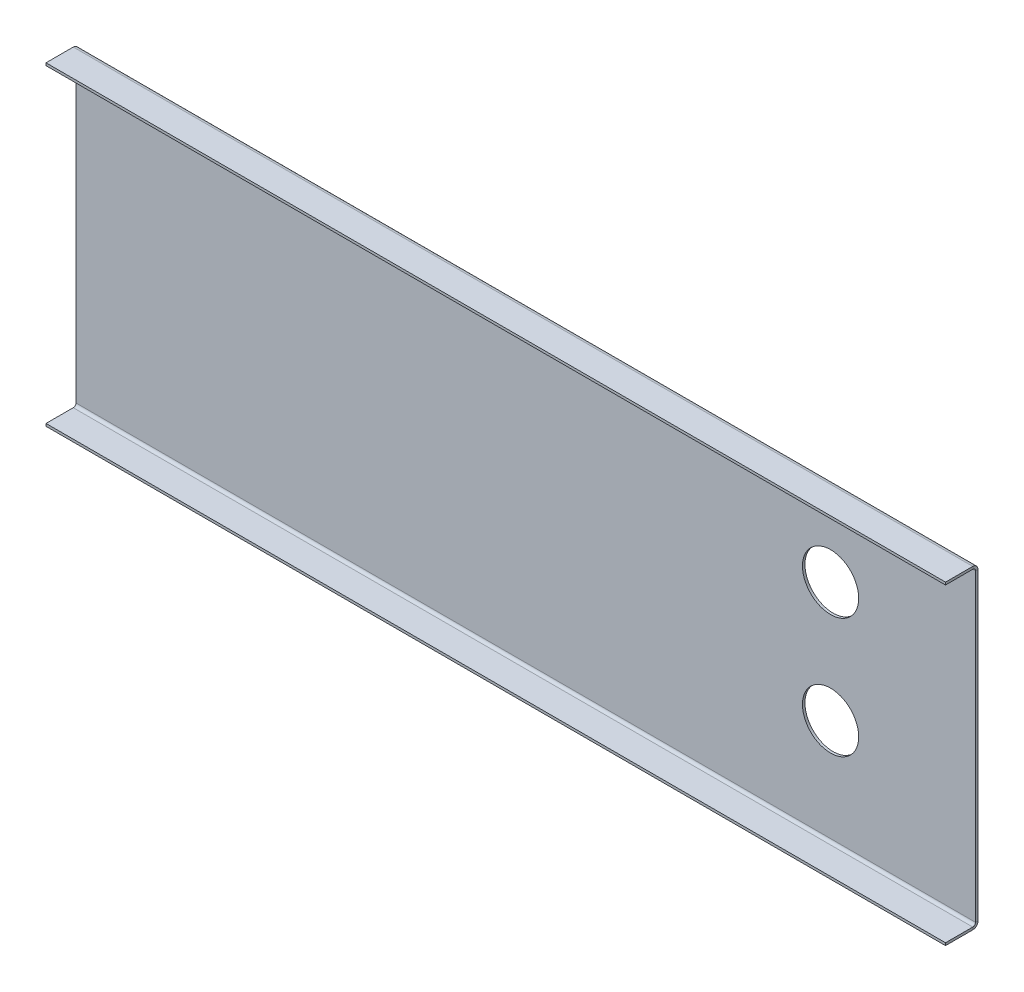
from build123d import *

# Parameters (mm, degrees)
SKETCH_1_W                         = 360
SKETCH_1_H                         = 124
SM_BASE_FLANGE_1_DEPTH             = 1
SM_EDGE_FLANGE_1_STRIP_W           = 6.2
SM_EDGE_FLANGE_1_STRIP_H           = 1
SM_EDGE_FLANGE_1_STRIP_CUT_DEPTH   = 360
SM_EDGE_FLANGE_1_STRIP_2_W         = 6.2
SM_EDGE_FLANGE_1_STRIP_2_H         = 1
SM_EDGE_FLANGE_1_STRIP_CUT_2_DEPTH = 360
SM_EDGE_FLANGE_1_DEPTH             = 360
SM_EDGE_FLANGE_1_BEND_DEPTH        = 360
SKETCH_8_R                         = 11.25
CUT_EXTRUDE_1_DEPTH                = 10


# Sheet-metal steps are written as plain solids
with BuildPart() as part:
    # Sketch 1 → Базовая кромка1 (new body)
    with BuildSketch(Plane.XY):
        with Locations((122.300049421, -36.452668213)):
            Rectangle(SKETCH_1_W, SKETCH_1_H)
    extrude(amount=-SM_BASE_FLANGE_1_DEPTH)

    # Ребро-кромка1 strip (across the edge) → Ребро-кромка1 strip cut (cut)
    with BuildSketch(Plane(origin=(302.300049421, 25.547331787, 0), x_dir=(0, -1, 0), z_dir=(-1, 0, 0))):
        with Locations((-2, -0.5)):
            Rectangle(SM_EDGE_FLANGE_1_STRIP_W, SM_EDGE_FLANGE_1_STRIP_H)
    extrude(amount=SM_EDGE_FLANGE_1_STRIP_CUT_DEPTH, mode=Mode.SUBTRACT)

    # Ребро-кромка1 strip 2 (across the edge) → Ребро-кромка1 strip cut 2 (cut)
    with BuildSketch(Plane(origin=(-57.699950579, -98.452668213, 0), x_dir=(0, 1, 0), z_dir=(1, 0, 0))):
        with Locations((-2, -0.5)):
            Rectangle(SM_EDGE_FLANGE_1_STRIP_2_W, SM_EDGE_FLANGE_1_STRIP_2_H)
    extrude(amount=SM_EDGE_FLANGE_1_STRIP_CUT_2_DEPTH, mode=Mode.SUBTRACT)

    # Ребро-кромка1 section (across the edge) → Ребро-кромка1 (add)
    with BuildSketch(Plane(origin=(302.300049421, 25.547331787, 0), x_dir=(0, -1, 0), z_dir=(-1, 0, 0))):
        with BuildLine():
            Line((-1, 1.1), (-1, 12))
            Line((-1, 12), (0, 12))
            Line((0, 12), (0, 1.1))
            ThreePointArc((0, 1.1), (0.322182541, 0.322182541), (1.1, 0))
            Line((1.1, 0), (1.1, -1))
            ThreePointArc((1.1, -1), (-0.38492424, -0.38492424), (-1, 1.1))
        make_face()
    extrude(amount=SM_EDGE_FLANGE_1_DEPTH)

    # Ребро-кромка1 section 2 (across the edge) → Ребро-кромка1 bend (add)
    with BuildSketch(Plane(origin=(-57.699950579, -98.452668213, 0), x_dir=(0, 1, 0), z_dir=(1, 0, 0))):
        with BuildLine():
            Line((-1, 1.1), (-1, 12))
            Line((-1, 12), (0, 12))
            Line((0, 12), (0, 1.1))
            ThreePointArc((0, 1.1), (0.322182541, 0.322182541), (1.1, 0))
            Line((1.1, 0), (1.1, -1))
            ThreePointArc((1.1, -1), (-0.38492424, -0.38492424), (-1, 1.1))
        make_face()
    extrude(amount=SM_EDGE_FLANGE_1_BEND_DEPTH)

    # Эскиз8 → Вырез-Вытянуть1 (cut)
    with BuildSketch(Plane(origin=(0, 0, -1), x_dir=(-1, 0, 0), z_dir=(0, 0, -1))):
        with Locations((-244.300049421, -8.452668213)):
            Circle(SKETCH_8_R)
        with Locations((-244.300049421, -56.452668213)):
            Circle(SKETCH_8_R)
    extrude(amount=-CUT_EXTRUDE_1_DEPTH, mode=Mode.SUBTRACT)


solid = part.part
